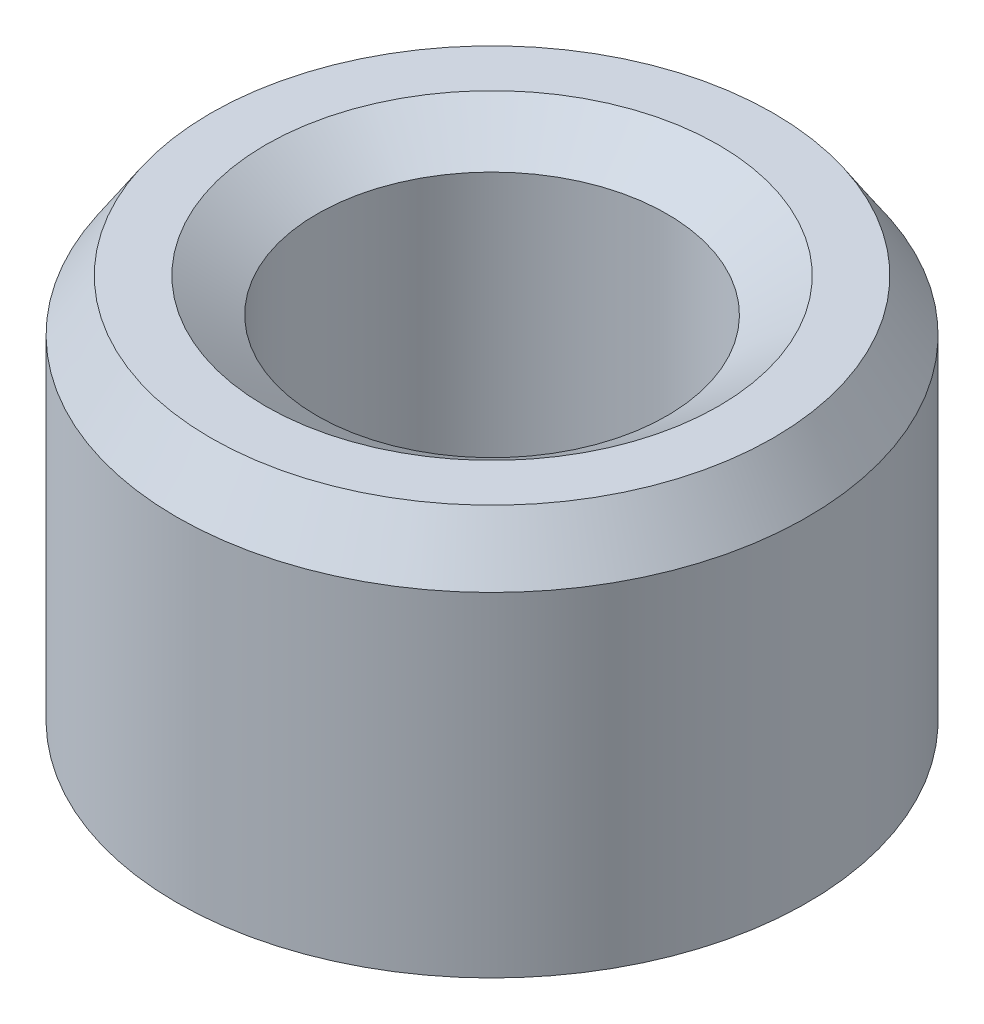
from build123d import *
from OCP.BRepFilletAPI import BRepFilletAPI_MakeChamfer

# Parameters (mm, degrees)
SKETCH1_R           = 5
BOSS_EXTRUDE1_DEPTH = 6.649556827
SKETCH2_R           = 2.773416124
CUT_EXTRUDE1_DEPTH  = 10.706523888
CHAMFER1_SIZE       = 0.816271554
CHAMFER1_SIZE2      = 0.540330711


with BuildPart() as part:
    # Sketch1 → Boss-Extrude1 (new body)
    with BuildSketch(Plane(origin=(0, 0, 0), x_dir=(1, 0, 0), z_dir=(0, 1, 0))):
        Circle(SKETCH1_R)
    extrude(amount=BOSS_EXTRUDE1_DEPTH)

    # Sketch2 → Cut-Extrude1 (cut, through all)
    with BuildSketch(Plane(origin=(0, 0, 0), x_dir=(1, 0, 0), z_dir=(0, 1, 0))):
        Circle(SKETCH2_R)
    extrude(amount=CUT_EXTRUDE1_DEPTH, mode=Mode.SUBTRACT)

    # Chamfer1: one chamfer whose edges measure the first distance from different faces: ONE call of the kernel's chamfer builder (chamfer() names one face for all edges)
    chamfer1_edges_1 = [part.edges().sort_by_distance(p)[0] for p in [
        (-2.773416124, 6.649556827, 0),
    ]]
    chamfer1_side_1 = [part.faces().sort_by_distance(p)[0] for p in [
        (-4.858578644, 6.649556827, 0),
    ]]
    chamfer1_edges_2 = [part.edges().sort_by_distance(p)[0] for p in [
        (-2.773416124, 0, 0),
    ]]
    chamfer1_side_2 = [part.faces().sort_by_distance(p)[0] for p in [
        (-2.773416124, 3.324778413, 0),
    ]]
    chamfer1_edges_3 = [part.edges().sort_by_distance(p)[0] for p in [
        (-5, 0, 0),
    ]]
    chamfer1_side_3 = [part.faces().sort_by_distance(p)[0] for p in [
        (-4.858578644, 0, 0),
    ]]
    chamfer1_edges_4 = [part.edges().sort_by_distance(p)[0] for p in [
        (-5, 6.649556827, 0),
    ]]
    chamfer1_side_4 = [part.faces().sort_by_distance(p)[0] for p in [
        (-5, 3.324778413, 0),
    ]]
    chamfer1 = BRepFilletAPI_MakeChamfer(part.part.solid().wrapped)
    for e in chamfer1_edges_1:
        chamfer1.Add(CHAMFER1_SIZE, CHAMFER1_SIZE2, e.wrapped, chamfer1_side_1[0].wrapped)  # the first distance lies on this face
    for e in chamfer1_edges_2:
        chamfer1.Add(CHAMFER1_SIZE, CHAMFER1_SIZE2, e.wrapped, chamfer1_side_2[0].wrapped)  # the first distance lies on this face
    for e in chamfer1_edges_3:
        chamfer1.Add(CHAMFER1_SIZE, CHAMFER1_SIZE2, e.wrapped, chamfer1_side_3[0].wrapped)  # the first distance lies on this face
    for e in chamfer1_edges_4:
        chamfer1.Add(CHAMFER1_SIZE, CHAMFER1_SIZE2, e.wrapped, chamfer1_side_4[0].wrapped)  # the first distance lies on this face
    add(Compound.cast(chamfer1.Shape()), mode=Mode.REPLACE)


solid = part.part
